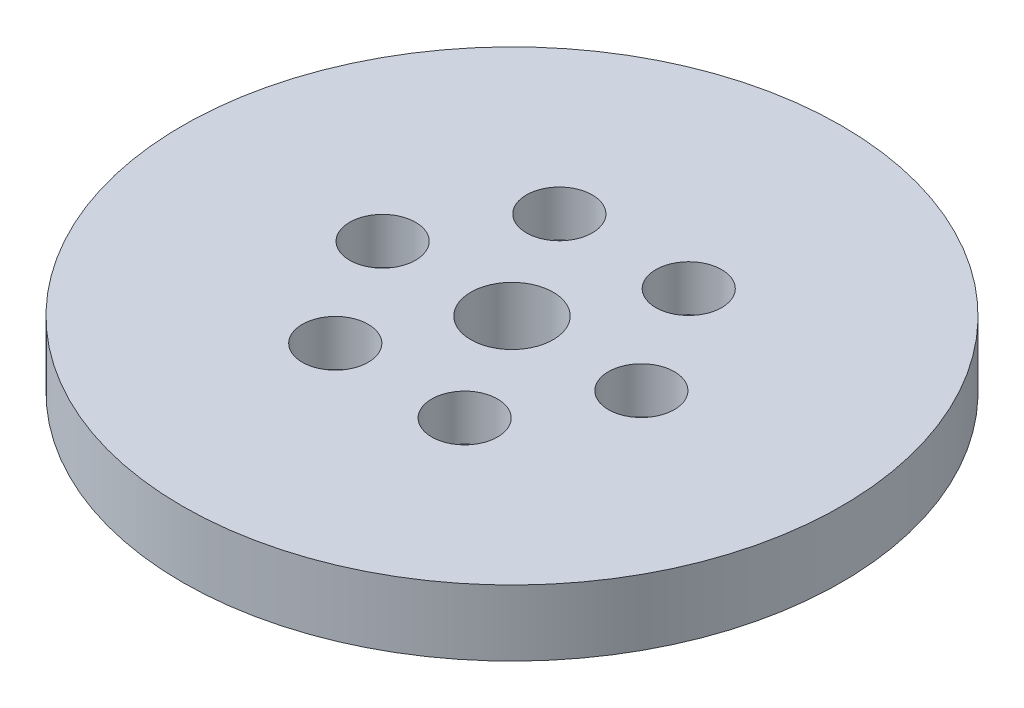
from build123d import *

# Parameters (mm, degrees)
SKETCH1_R           = 100
BOSS_EXTRUDE1_DEPTH = 20
SKETCH2_R           = 12.5
CUT_EXTRUDE1_DEPTH  = 143.828568571
SKETCH3_R           = 10
CUT_EXTRUDE2_DEPTH  = 13.924141382
CIRPATTERN1_COUNT   = 6


with BuildPart() as part:
    # Sketch1 → Boss-Extrude1 (new body)
    with BuildSketch(Plane(origin=(0, 0, 0), x_dir=(1, 0, 0), z_dir=(0, 1, 0))):
        Circle(SKETCH1_R)
    extrude(amount=BOSS_EXTRUDE1_DEPTH)

    # Sketch2 → Cut-Extrude1 (cut, through all)
    with BuildSketch(Plane(origin=(0, 0, 0), x_dir=(1, 0, 0), z_dir=(0, 1, 0))):
        Circle(SKETCH2_R)
    extrude(amount=CUT_EXTRUDE1_DEPTH, mode=Mode.SUBTRACT)

    # Sketch3 → Cut-Extrude2 (cut)
    with BuildSketch(Plane(origin=(0, 20, 0), x_dir=(1, 0, 0), z_dir=(0, 1, 0))):
        with Locations((-39.259863889, 0)):
            Circle(SKETCH3_R)
    cut_extrude2 = extrude(amount=-CUT_EXTRUDE2_DEPTH, mode=Mode.SUBTRACT)

    # CirPattern1: Cut-Extrude2 ×6 about axis
    cirpattern1_axis = Axis((0, 0, 0), (0, 1, 0))
    for i in range(1, CIRPATTERN1_COUNT):
        add(cut_extrude2.rotate(cirpattern1_axis, i * 360 / CIRPATTERN1_COUNT), mode=Mode.SUBTRACT)


solid = part.part
